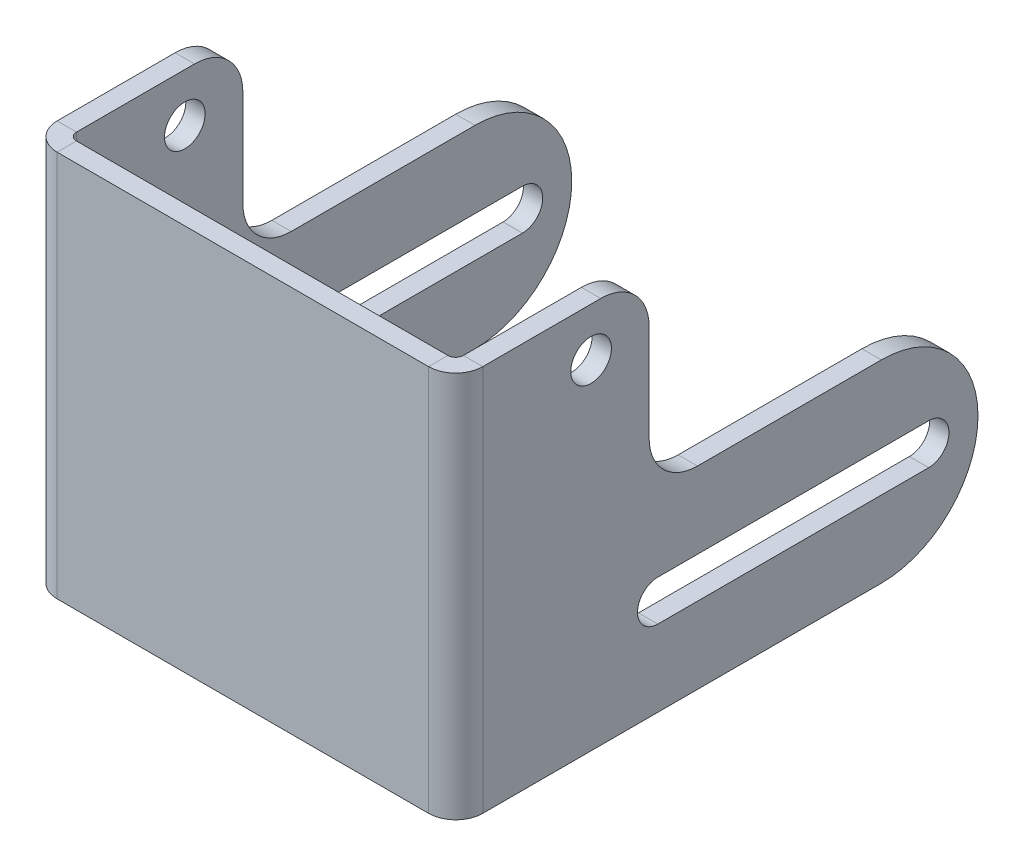
from build123d import *

# Parameters (mm, degrees)
BASE_FLANGE1_DEPTH = 40
SKETCH6_W          = 34
SKETCH6_H          = 20
CUT_EXTRUDE1_DEPTH = 79.993670633
FILLET1_R          = 10
FILLET2_R          = 5
SKETCH7_R          = 2.1
CUT_EXTRUDE2_DEPTH = 79.993670633


# Read off the part's stored shape, not the designer's step: Base-Flange1
with BuildPart() as part:
    # Base-Flange1 outline → Base-Flange1 (new body)
    with BuildSketch(Plane(origin=(0, 0, 0), x_dir=(1, 0, 0), z_dir=(0, 1, 0))):
        with BuildLine():
            Line((-20, 0.8), (-20, 52))
            Line((-20, 52), (-22, 52))
            Line((-22, 52), (-22, 0.8))
            ThreePointArc((-22, 0.8), (-21.179898987, -1.179898987), (-19.2, -2))
            Line((-19.2, -2), (19.2, -2))
            ThreePointArc((19.2, -2), (21.179898987, -1.179898987), (22, 0.8))
            Line((22, 0.8), (22, 52))
            Line((22, 52), (20, 52))
            Line((20, 52), (20, 0.8))
            ThreePointArc((20, 0.8), (19.765685425, 0.234314575), (19.2, 0))
            Line((19.2, 0), (-19.2, 0))
            ThreePointArc((-19.2, 0), (-19.765685425, 0.234314575), (-20, 0.8))
        make_face()
    extrude(amount=BASE_FLANGE1_DEPTH)

    # Sketch6 → Cut-Extrude1 (cut, through all)
    with BuildSketch(Plane(origin=(22, 0, 0), x_dir=(0, 0, -1), z_dir=(1, 0, 0))):
        with Locations((35, 30)):
            Rectangle(SKETCH6_W, SKETCH6_H)
    extrude(amount=-CUT_EXTRUDE1_DEPTH, mode=Mode.SUBTRACT)

    # Fillet1
    fillet1_edges = [part.edges().sort_by_distance(p)[0] for p in [
        (-21, 0, -52),
        (-21, 20, -52),
        (21, 0, -52),
        (21, 20, -52),
    ]]
    fillet(fillet1_edges, radius=FILLET1_R - 0.0001)  # a hair under: the kernel refuses the full size

    # Fillet2
    fillet2_edges = [part.edges().sort_by_distance(p)[0] for p in [
        (-21, 40, -18),
        (21, 40, -18),
        (-21, 20, -18),
        (21, 20, -18),
    ]]
    fillet(fillet2_edges, radius=FILLET2_R)

    # Sketch7 → Cut-Extrude2 (cut, through all)
    with BuildSketch(Plane(origin=(22, 0, 0), x_dir=(0, 0, -1), z_dir=(1, 0, 0))):
        with Locations((12, 35)):
            Circle(SKETCH7_R)
        with BuildLine():
            Line((18.9, 12.1), (46.9, 12.1))
            ThreePointArc((46.9, 12.1), (49, 10), (46.9, 7.9))
            Line((46.9, 7.9), (18.9, 7.9))
            ThreePointArc((18.9, 7.9), (16.8, 10), (18.9, 12.1))
        make_face()
    extrude(amount=-CUT_EXTRUDE2_DEPTH, mode=Mode.SUBTRACT)


solid = part.part
